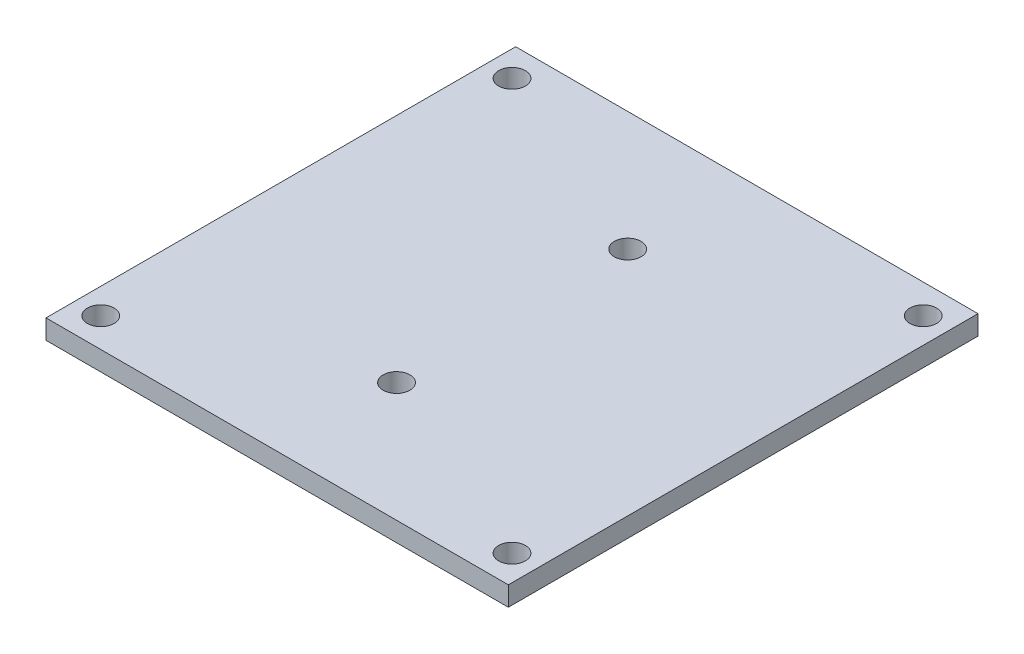
from build123d import *

# Parameters (mm, degrees)
SKETCH1_W           = 38
SKETCH1_H           = 38.6
SKETCH1_R           = 1.1
BOSS_EXTRUDE1_DEPTH = 1.6
BOSS_EXTRUDE2_START = -2.3
SKETCH1_3_W         = 32
SKETCH1_3_H         = 28.6
SKETCH1_3_R         = 1.1
BOSS_EXTRUDE2_DEPTH = 2.3


with BuildPart() as part:
    # Sketch1 → Boss-Extrude1 (new body)
    with BuildSketch(Plane(origin=(0, 0, 0), x_dir=(1, 0, 0), z_dir=(0, 1, 0))):
        Rectangle(SKETCH1_W, SKETCH1_H)
        with Locations((0.008140781, -9.5)):
            Circle(SKETCH1_R, mode=Mode.SUBTRACT)
        with Locations((0.008140781, 9.5)):
            Circle(SKETCH1_R, mode=Mode.SUBTRACT)
        with Locations((-16.9, -16.9)):
            Circle(SKETCH1_R, mode=Mode.SUBTRACT)
        with Locations((16.9, -16.9)):
            Circle(SKETCH1_R, mode=Mode.SUBTRACT)
        with Locations((-16.9, 16.9)):
            Circle(SKETCH1_R, mode=Mode.SUBTRACT)
        with Locations((16.9, 16.9)):
            Circle(SKETCH1_R, mode=Mode.SUBTRACT)
    extrude(amount=BOSS_EXTRUDE1_DEPTH)

    # Sketch1<3> → Boss-Extrude2 (add)
    with BuildSketch(Plane(origin=(0, 0, 0), x_dir=(1, 0, 0), z_dir=(0, 1, 0)).offset(BOSS_EXTRUDE2_START)):
        Rectangle(SKETCH1_3_W, SKETCH1_3_H)
        with Locations((0.008140781, -9.5)):
            Circle(SKETCH1_3_R, mode=Mode.SUBTRACT)
        with Locations((0.008140781, 9.5)):
            Circle(SKETCH1_3_R, mode=Mode.SUBTRACT)
    extrude(amount=BOSS_EXTRUDE2_DEPTH)


solid = part.part
